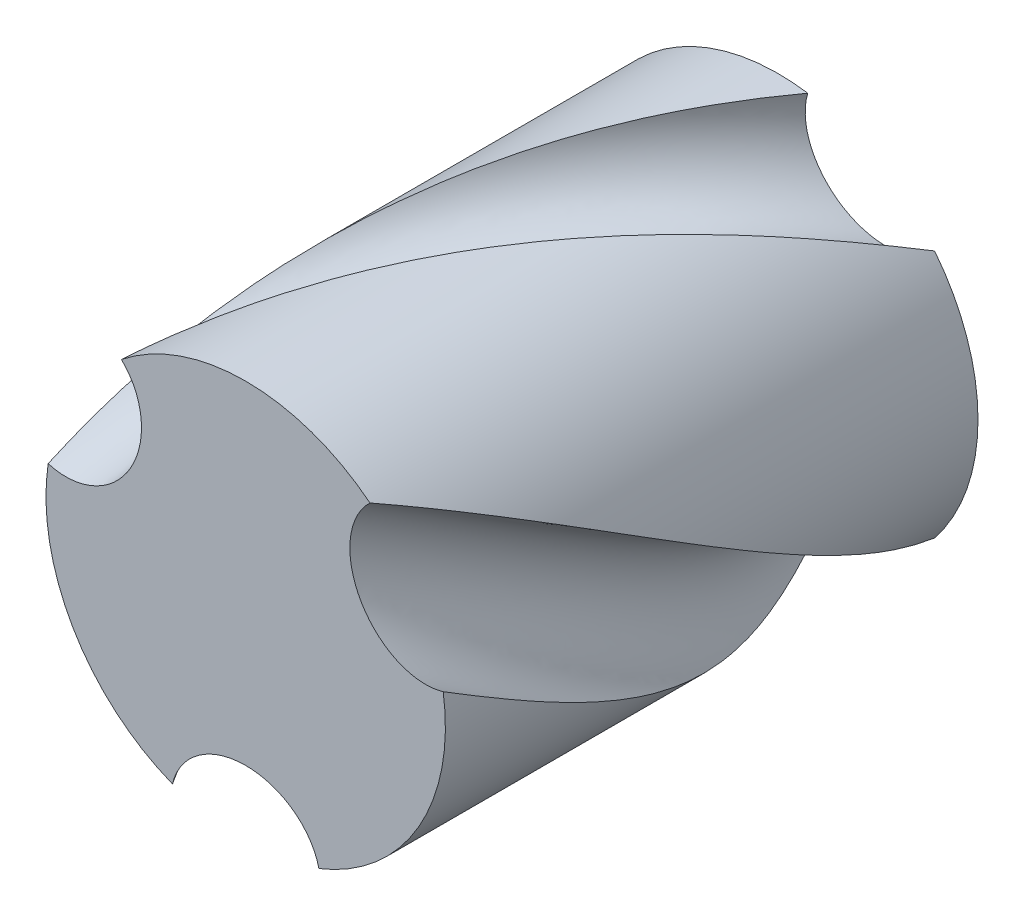
from build123d import *

# Parameters (mm, degrees)
SKIZZE1_2_R                     = 7.5
AUFSATZ_LINEAR_AUSTRAGEN2_DEPTH = 20
SCHNITT_AUSTRAGUNG3_PITCH       = 80
KREISMUSTER3_COUNT              = 3


with BuildPart() as part:
    # Skizze1<2> → Aufsatz-Linear austragen2 (new body)
    with BuildSketch(Plane.XY):
        Circle(SKIZZE1_2_R)
    extrude(amount=AUFSATZ_LINEAR_AUSTRAGEN2_DEPTH)

    # Schnitt-Austragung3: arcs per turn and ends read off the stored shape
    # Schnitt-Austragung3: the profile of Skizze13 screwed along a right-hand helix through 2 turns, 32 arcs to a turn; built about Z, then put on its axis
    schnitt_austragung3_z = Axis((0, 0, 0), (0, 0, 1))
    schnitt_austragung3_corners = [(5, 0, -80), (7.5, -1.767766953, -78.232233047), (10, 0, -80), (7.5, 1.767766953, -81.767766953)]
    with BuildLine(mode=Mode.PRIVATE) as schnitt_austragung3_profile:
        ThreePointArc((5, 0, -80), (5.732233047, -1.25, -78.75), (7.5, -1.767766953, -78.232233047))
        ThreePointArc((7.5, -1.767766953, -78.232233047), (9.267766953, -1.25, -78.75), (10, 0, -80))
        ThreePointArc((10, 0, -80), (9.267766953, 1.25, -81.25), (7.5, 1.767766953, -81.767766953))
        ThreePointArc((7.5, 1.767766953, -81.767766953), (5.732233047, 1.25, -81.25), (5, 0, -80))
    schnitt_austragung3_cap = Face(schnitt_austragung3_profile.wire())
    schnitt_austragung3_arcs = [((5, 0, -80), (5, -1.767766953, -78.232233047), (7.5, -1.767766953, -78.232233047), (1, 0.7071067811865475, 1)), ((7.5, -1.767766953, -78.232233047), (10, -1.767766953, -78.232233047), (10, 0, -80), (1, 0.7071067811865475, 1)), ((10, 0, -80), (10, 1.767766953, -81.767766953), (7.5, 1.767766953, -81.767766953), (1, 0.7071067811865475, 1)), ((7.5, 1.767766953, -81.767766953), (5, 1.767766953, -81.767766953), (5, 0, -80), (1, 0.7071067811865475, 1))]  # start, shoulder, end, weights
    schnitt_austragung3_turn_angles = [0, 5.625, 11.25, 16.875, 22.5, 28.125, 33.75, 39.375, 45, 50.625, 56.25, 61.875, 67.5, 73.125, 78.75, 84.375, 90, 95.625, 101.25, 106.875, 112.5, 118.125, 123.75, 129.375, 135, 140.625, 146.25, 151.875, 157.5, 163.125, 168.75, 174.375, 180, 185.625, 191.25, 196.875, 202.5, 208.125, 213.75, 219.375, 225, 230.625, 236.25, 241.875, 247.5, 253.125, 258.75, 264.375, 270, 275.625, 281.25, 286.875, 292.5, 298.125, 303.75, 309.375, 315, 320.625, 326.25, 331.875, 337.5, 343.125, 348.75, 354.375, 360]
    schnitt_austragung3_turn_weights = [1, 0.9951847266721969, 1, 0.9951847266721969, 1, 0.9951847266721969, 1, 0.9951847266721969, 1, 0.9951847266721969, 1, 0.9951847266721969, 1, 0.9951847266721969, 1, 0.9951847266721969, 1, 0.9951847266721969, 1, 0.9951847266721969, 1, 0.9951847266721969, 1, 0.9951847266721969, 1, 0.9951847266721969, 1, 0.9951847266721969, 1, 0.9951847266721969, 1, 0.9951847266721969, 1, 0.9951847266721969, 1, 0.9951847266721969, 1, 0.9951847266721969, 1, 0.9951847266721969, 1, 0.9951847266721969, 1, 0.9951847266721969, 1, 0.9951847266721969, 1, 0.9951847266721969, 1, 0.9951847266721969, 1, 0.9951847266721969, 1, 0.9951847266721969, 1, 0.9951847266721969, 1, 0.9951847266721969, 1, 0.9951847266721969, 1, 0.9951847266721969, 1, 0.9951847266721969, 1]
    schnitt_austragung3_turn_sides = [Face.make_bezier_surface([[Vector(p[j][0], p[j][1], 0).rotate(schnitt_austragung3_z, schnitt_austragung3_turn_angles[2 * i + k]) / schnitt_austragung3_turn_weights[2 * i + k] + Vector(0, 0, p[j][2] + SCHNITT_AUSTRAGUNG3_PITCH * schnitt_austragung3_turn_angles[2 * i + k] / 360) for k in range(3)] for j in range(3)], [[p[3][j] * schnitt_austragung3_turn_weights[2 * i + k] for k in range(3)] for j in range(3)]) for p in schnitt_austragung3_arcs for i in range(32)]
    schnitt_austragung3 = Plane(origin=(0, 0, 0), x_dir=(-1, 0, 0), z_dir=(0, 0, 1)) * Solid(Shell([*[p.moved(Location((0, 0, SCHNITT_AUSTRAGUNG3_PITCH * i))) for i in range(2) for p in schnitt_austragung3_turn_sides], schnitt_austragung3_cap, schnitt_austragung3_cap.rotate(schnitt_austragung3_z, 720).moved(Location((0, 0, SCHNITT_AUSTRAGUNG3_PITCH * 720 / 360)))]))
    add(schnitt_austragung3, mode=Mode.SUBTRACT)

    # Kreismuster3: Schnitt-Austragung3 ×3 about axis
    kreismuster3_axis = Axis((0, 0, 0), (0, 0, 1))
    for i in range(1, KREISMUSTER3_COUNT):
        add(schnitt_austragung3.rotate(kreismuster3_axis, i * 360 / KREISMUSTER3_COUNT), mode=Mode.SUBTRACT)


solid = part.part
